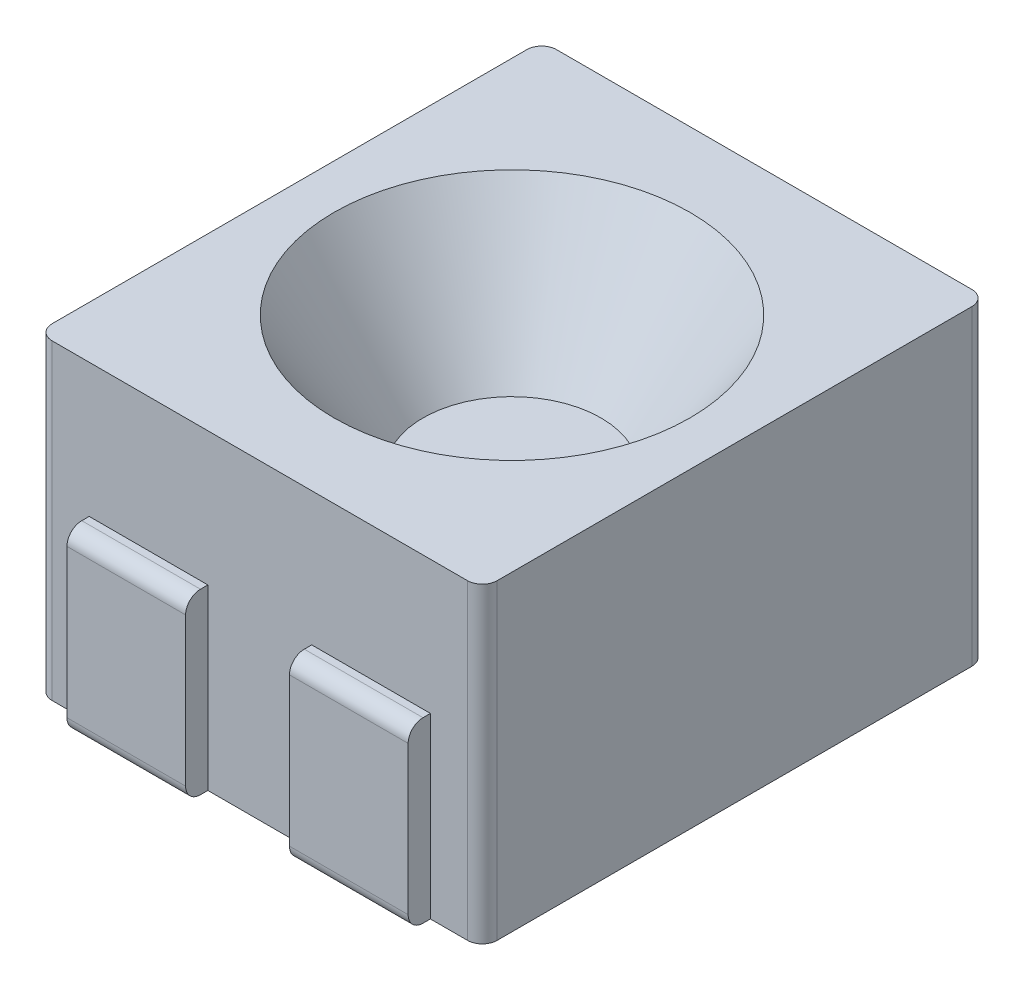
from build123d import *

# Parameters (mm, degrees)
SKETCH1_W            = 3
SKETCH1_H            = 3.4
BOSS_EXTRUDE1_DEPTH  = 2.1
SKETCH2_W            = 0.8
SKETCH2_H            = 1.2
BOSS_EXTRUDE2_DEPTH  = 0.15
FILLET1_R            = 0.1
FILLET1_OF_MIRROR1_R = 0.1
MIRROR2_START        = -1.15
MIRROR2_DEPTH        = 0.8
MIRROR2_START_2      = 0.35
MIRROR2_2_DEPTH      = 0.8
FILLET2_R            = 0.1


# Read off the part's stored shape, not the designer's step: Mirror2
with BuildPart() as part:
    # Sketch1 → Boss-Extrude1 (new body)
    with BuildSketch(Plane(origin=(0, 0, 0), x_dir=(1, 0, 0), z_dir=(0, 1, 0))):
        Rectangle(SKETCH1_W, SKETCH1_H)
    extrude(amount=BOSS_EXTRUDE1_DEPTH)

    # Sketch2 → Boss-Extrude2 (add)
    with BuildSketch(Plane.XY.offset(1.7)):
        with Locations((-0.75, 0.6)):
            Rectangle(SKETCH2_W, SKETCH2_H)
    boss_extrude2 = extrude(amount=BOSS_EXTRUDE2_DEPTH)

    # Fillet1
    fillet1_edges = [part.edges().sort_by_distance(p)[0] for p in [
        (-0.75, 0, 1.85),
        (-0.75, 1.2, 1.85),
    ]]
    fillet(fillet1_edges, radius=FILLET1_R)

    # Mirror1: Boss-Extrude2 across plane
    add(boss_extrude2.mirror(Plane(origin=(0, 0, 0), x_dir=(0, 0, 1), z_dir=(1, 0, 0))))

    # Fillet1 of Mirror1
    fillet1_of_mirror1_edges = [part.edges().sort_by_distance(p)[0] for p in [
        (0.75, 0, 1.85),
        (0.75, 1.2, 1.85),
    ]]
    fillet(fillet1_of_mirror1_edges, radius=FILLET1_OF_MIRROR1_R)

    # Mirror2 outline → Mirror2 (add)
    with BuildSketch(Plane.YZ.offset(MIRROR2_START)):
        with BuildLine():
            Line((1.2, -1.75), (1.2, -1.7))
            Line((1.2, -1.7), (0, -1.7))
            Line((0, -1.7), (0, -1.75))
            ThreePointArc((0, -1.75), (0.029289322, -1.820710678), (0.1, -1.85))
            Line((0.1, -1.85), (1.1, -1.85))
            ThreePointArc((1.1, -1.85), (1.170710678, -1.820710678), (1.2, -1.75))
        make_face()
    extrude(amount=MIRROR2_DEPTH)

    # Mirror2 2 outline → Mirror2 2 (add)
    with BuildSketch(Plane.YZ.offset(MIRROR2_START_2)):
        with BuildLine():
            Line((1.2, -1.75), (1.2, -1.7))
            Line((1.2, -1.7), (0, -1.7))
            Line((0, -1.7), (0, -1.75))
            ThreePointArc((0, -1.75), (0.029289322, -1.820710678), (0.1, -1.85))
            Line((0.1, -1.85), (1.1, -1.85))
            ThreePointArc((1.1, -1.85), (1.170710678, -1.820710678), (1.2, -1.75))
        make_face()
    extrude(amount=MIRROR2_2_DEPTH)

    # Sketch11 → Cut-Revolve1 (revolve, cut)
    with BuildSketch(Plane(origin=(0, 0, 0), x_dir=(0, 0, -1), z_dir=(1, 0, 0))):
        Polygon((0, 2.1), (-1.2, 2.1), (-0.6, 1.2), (0, 1.2), align=None)
    revolve(axis=Axis((0, 2.1, 0), (0, -1, 0)), mode=Mode.SUBTRACT)

    # Fillet2
    fillet2_edges = [part.edges().sort_by_distance(p)[0] for p in [
        (-1.5, 1.05, -1.7),
        (1.5, 1.05, -1.7),
        (-1.5, 1.05, 1.7),
        (1.5, 1.05, 1.7),
    ]]
    fillet(fillet2_edges, radius=FILLET2_R)


solid = part.part
